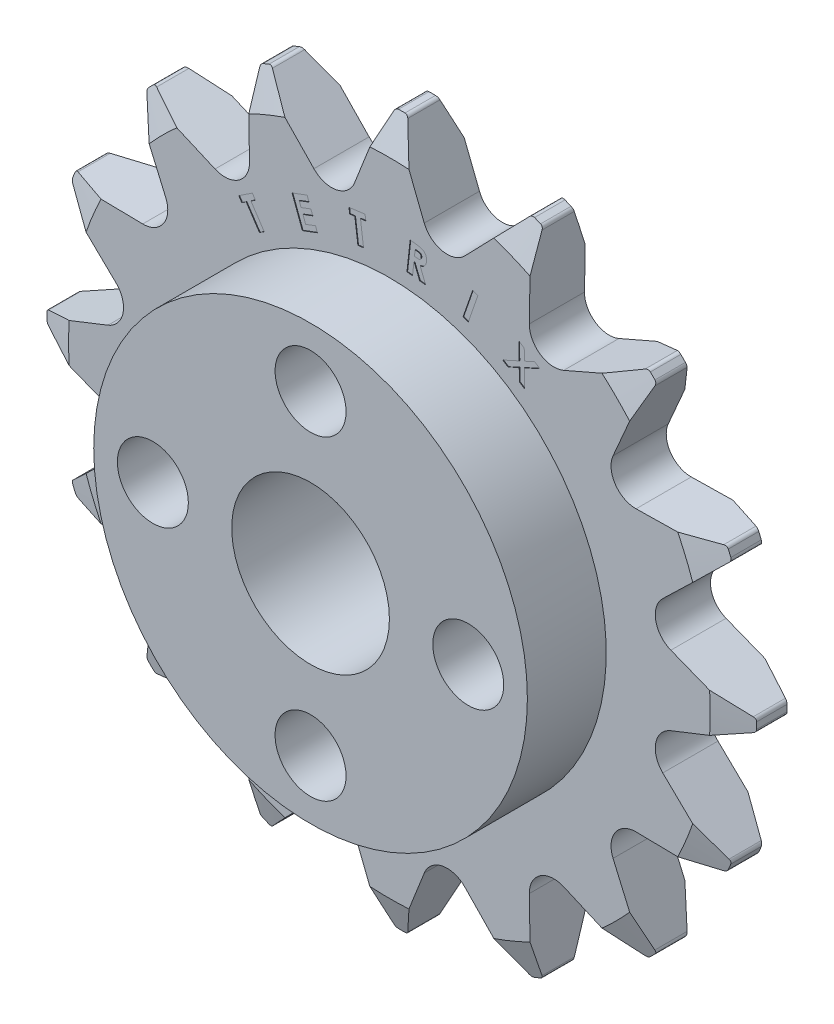
from build123d import *

# Parameters (mm, degrees)
EXTRUDE2_START     = -14.41724753
EXTRUDE2_DEPTH     = 1.63449506
EXTRUDE2_START_2   = -2.8
EXTRUDE2_2_DEPTH   = 2.8
SKETCH3_R          = 7.254666381
EXTRUDE3_DEPTH     = 2.8
SKETCH4_R          = 11
EXTRUDE4_DEPTH     = 4
SKETCH6_R          = 4
SKETCH6_R_2        = 1.8
EXTRUDE6_DEPTH     = 27.348434651
CUT_EXTRUDE1_DEPTH = 0.03125


with BuildPart() as part:
    # Extrude2: read off the stored shape, not the designer's step
    # Extrude2 outline → Extrude2 (new body)
    with BuildSketch(Plane(origin=(0, 0, -15), x_dir=(-1, 0, 0), z_dir=(0, 0, -1)).offset(EXTRUDE2_START)):
        with BuildLine():
            ThreePointArc((12.844111786, 12.610661855), (12.727922061, 12.727922061), (12.610661855, 12.844111786))
            ThreePointArc((12.610661855, 12.844111786), (12.50701837, 12.898045246), (12.390927078, 12.884869439))
            Line((12.390927078, 12.884869439), (8.845044699, 11.34614339))
            ThreePointArc((8.845044699, 11.34614339), (7.65297996, 11.453493909), (7.097617587, 12.513736858))
            Line((7.097617587, 12.513736858), (7.162264649, 16.378549979))
            ThreePointArc((7.162264649, 16.378549979), (7.130011294, 16.490846511), (7.04052063, 16.565961163))
            ThreePointArc((7.04052063, 16.565961163), (6.888301783, 16.629831585), (6.735503595, 16.692303356))
            ThreePointArc((6.735503595, 16.692303356), (6.619110059, 16.702468731), (6.516897854, 16.645869658))
            Line((6.516897854, 16.645869658), (3.829774665, 13.867321716))
            ThreePointArc((3.829774665, 13.867321716), (2.687369186, 13.510317238), (1.768543845, 14.277326018))
            Line((1.768543845, 14.277326018), (0.349269993, 17.872687117))
            ThreePointArc((0.349269993, 17.872687117), (0.276497756, 17.96409276), (0.16507403, 17.999243055))
            ThreePointArc((0.16507403, 17.999243055), (0, 18), (-0.16507403, 17.999243055))
            ThreePointArc((-0.16507403, 17.999243055), (-0.276497756, 17.96409276), (-0.349269993, 17.872687117))
            Line((-0.349269993, 17.872687117), (-1.768543845, 14.277326018))
            ThreePointArc((-1.768543845, 14.277326018), (-2.687369186, 13.510317238), (-3.829774665, 13.867321716))
            Line((-3.829774665, 13.867321716), (-6.516897854, 16.645869658))
            ThreePointArc((-6.516897854, 16.645869658), (-6.619110059, 16.702468731), (-6.735503595, 16.692303356))
            ThreePointArc((-6.735503595, 16.692303356), (-6.888301783, 16.629831585), (-7.04052063, 16.565961163))
            ThreePointArc((-7.04052063, 16.565961163), (-7.130011294, 16.490846511), (-7.162264649, 16.378549979))
            Line((-7.162264649, 16.378549979), (-7.097617587, 12.513736858))
            ThreePointArc((-7.097617587, 12.513736858), (-7.65297996, 11.453493909), (-8.845044699, 11.34614339))
            Line((-8.845044699, 11.34614339), (-12.390927078, 12.884869439))
            ThreePointArc((-12.390927078, 12.884869439), (-12.50701837, 12.898045246), (-12.610661855, 12.844111786))
            ThreePointArc((-12.610661855, 12.844111786), (-12.727922061, 12.727922061), (-12.844111786, 12.610661855))
            ThreePointArc((-12.844111786, 12.610661855), (-12.898045246, 12.50701837), (-12.884869439, 12.390927078))
            Line((-12.884869439, 12.390927078), (-11.34614339, 8.845044699))
            ThreePointArc((-11.34614339, 8.845044699), (-11.453493909, 7.65297996), (-12.513736858, 7.097617587))
            Line((-12.513736858, 7.097617587), (-16.378549979, 7.162264649))
            ThreePointArc((-16.378549979, 7.162264649), (-16.490846511, 7.130011294), (-16.565961163, 7.04052063))
            ThreePointArc((-16.565961163, 7.04052063), (-16.629831585, 6.888301783), (-16.692303356, 6.735503595))
            ThreePointArc((-16.692303356, 6.735503595), (-16.702468731, 6.619110059), (-16.645869658, 6.516897854))
            Line((-16.645869658, 6.516897854), (-13.867321716, 3.829774665))
            ThreePointArc((-13.867321716, 3.829774665), (-13.510317238, 2.687369186), (-14.277326018, 1.768543845))
            Line((-14.277326018, 1.768543845), (-17.872687117, 0.349269993))
            ThreePointArc((-17.872687117, 0.349269993), (-17.96409276, 0.276497756), (-17.999243055, 0.16507403))
            ThreePointArc((-17.999243055, 0.16507403), (-18, 0), (-17.999243055, -0.16507403))
            ThreePointArc((-17.999243055, -0.16507403), (-17.96409276, -0.276497756), (-17.872687117, -0.349269993))
            Line((-17.872687117, -0.349269993), (-14.277326018, -1.768543845))
            ThreePointArc((-14.277326018, -1.768543845), (-13.510317238, -2.687369186), (-13.867321716, -3.829774665))
            Line((-13.867321716, -3.829774665), (-16.645869658, -6.516897854))
            ThreePointArc((-16.645869658, -6.516897854), (-16.702468731, -6.619110059), (-16.692303356, -6.735503595))
            ThreePointArc((-16.692303356, -6.735503595), (-16.629831585, -6.888301783), (-16.565961163, -7.04052063))
            ThreePointArc((-16.565961163, -7.04052063), (-16.490846511, -7.130011294), (-16.378549979, -7.162264649))
            Line((-16.378549979, -7.162264649), (-12.513736858, -7.097617587))
            ThreePointArc((-12.513736858, -7.097617587), (-11.453493909, -7.65297996), (-11.34614339, -8.845044699))
            Line((-11.34614339, -8.845044699), (-12.884869439, -12.390927078))
            ThreePointArc((-12.884869439, -12.390927078), (-12.898045246, -12.50701837), (-12.844111786, -12.610661855))
            ThreePointArc((-12.844111786, -12.610661855), (-12.727922061, -12.727922061), (-12.610661855, -12.844111786))
            ThreePointArc((-12.610661855, -12.844111786), (-12.50701837, -12.898045246), (-12.390927078, -12.884869439))
            Line((-12.390927078, -12.884869439), (-8.845044699, -11.34614339))
            ThreePointArc((-8.845044699, -11.34614339), (-7.65297996, -11.453493909), (-7.097617587, -12.513736858))
            Line((-7.097617587, -12.513736858), (-7.162264649, -16.378549979))
            ThreePointArc((-7.162264649, -16.378549979), (-7.130011294, -16.490846511), (-7.04052063, -16.565961163))
            ThreePointArc((-7.04052063, -16.565961163), (-6.888301783, -16.629831585), (-6.735503595, -16.692303356))
            ThreePointArc((-6.735503595, -16.692303356), (-6.619110059, -16.702468731), (-6.516897854, -16.645869658))
            Line((-6.516897854, -16.645869658), (-3.829774665, -13.867321716))
            ThreePointArc((-3.829774665, -13.867321716), (-2.687369186, -13.510317238), (-1.768543845, -14.277326018))
            Line((-1.768543845, -14.277326018), (-0.349269993, -17.872687117))
            ThreePointArc((-0.349269993, -17.872687117), (-0.276497756, -17.96409276), (-0.16507403, -17.999243055))
            ThreePointArc((-0.16507403, -17.999243055), (0, -18), (0.16507403, -17.999243055))
            ThreePointArc((0.16507403, -17.999243055), (0.276497756, -17.96409276), (0.349269993, -17.872687117))
            Line((0.349269993, -17.872687117), (1.768543845, -14.277326018))
            ThreePointArc((1.768543845, -14.277326018), (2.687369186, -13.510317238), (3.829774665, -13.867321716))
            Line((3.829774665, -13.867321716), (6.516897854, -16.645869658))
            ThreePointArc((6.516897854, -16.645869658), (6.619110059, -16.702468731), (6.735503595, -16.692303356))
            ThreePointArc((6.735503595, -16.692303356), (6.888301783, -16.629831585), (7.04052063, -16.565961163))
            ThreePointArc((7.04052063, -16.565961163), (7.130011294, -16.490846511), (7.162264649, -16.378549979))
            Line((7.162264649, -16.378549979), (7.097617587, -12.513736858))
            ThreePointArc((7.097617587, -12.513736858), (7.65297996, -11.453493909), (8.845044699, -11.34614339))
            Line((8.845044699, -11.34614339), (12.390927078, -12.884869439))
            ThreePointArc((12.390927078, -12.884869439), (12.50701837, -12.898045246), (12.610661855, -12.844111786))
            ThreePointArc((12.610661855, -12.844111786), (12.727922061, -12.727922061), (12.844111786, -12.610661855))
            ThreePointArc((12.844111786, -12.610661855), (12.898045246, -12.50701837), (12.884869439, -12.390927078))
            Line((12.884869439, -12.390927078), (11.34614339, -8.845044699))
            ThreePointArc((11.34614339, -8.845044699), (11.453493909, -7.65297996), (12.513736858, -7.097617587))
            Line((12.513736858, -7.097617587), (16.378549979, -7.162264649))
            ThreePointArc((16.378549979, -7.162264649), (16.490846511, -7.130011294), (16.565961163, -7.04052063))
            ThreePointArc((16.565961163, -7.04052063), (16.629831585, -6.888301783), (16.692303356, -6.735503595))
            ThreePointArc((16.692303356, -6.735503595), (16.702468731, -6.619110059), (16.645869658, -6.516897854))
            Line((16.645869658, -6.516897854), (13.867321716, -3.829774665))
            ThreePointArc((13.867321716, -3.829774665), (13.510317238, -2.687369186), (14.277326018, -1.768543845))
            Line((14.277326018, -1.768543845), (17.872687117, -0.349269993))
            ThreePointArc((17.872687117, -0.349269993), (17.96409276, -0.276497756), (17.999243055, -0.16507403))
            ThreePointArc((17.999243055, -0.16507403), (18, 0), (17.999243055, 0.16507403))
            ThreePointArc((17.999243055, 0.16507403), (17.96409276, 0.276497756), (17.872687117, 0.349269993))
            Line((17.872687117, 0.349269993), (14.277326018, 1.768543845))
            ThreePointArc((14.277326018, 1.768543845), (13.510317238, 2.687369186), (13.867321716, 3.829774665))
            Line((13.867321716, 3.829774665), (16.645869658, 6.516897854))
            ThreePointArc((16.645869658, 6.516897854), (16.702468731, 6.619110059), (16.692303356, 6.735503595))
            ThreePointArc((16.692303356, 6.735503595), (16.629831585, 6.888301783), (16.565961163, 7.04052063))
            ThreePointArc((16.565961163, 7.04052063), (16.490846511, 7.130011294), (16.378549979, 7.162264649))
            Line((16.378549979, 7.162264649), (12.513736858, 7.097617587))
            ThreePointArc((12.513736858, 7.097617587), (11.453493909, 7.65297996), (11.34614339, 8.845044699))
            Line((11.34614339, 8.845044699), (12.884869439, 12.390927078))
            ThreePointArc((12.884869439, 12.390927078), (12.898045246, 12.50701837), (12.844111786, 12.610661855))
        make_face()
        with BuildLine():
            Line((1.5, 6.169696007), (1.5, 4.769696007))
            ThreePointArc((1.5, 4.769696007), (0, -5), (-1.5, 4.769696007))
            Line((-1.5, 4.769696007), (-1.5, 6.169696007))
            Line((-1.5, 6.169696007), (1.5, 6.169696007))
        make_face(mode=Mode.SUBTRACT)
    extrude(amount=EXTRUDE2_DEPTH)

    # Extrude2 2 outline → Extrude2 2 (add)
    with BuildSketch(Plane.XY.offset(EXTRUDE2_START_2)):
        with BuildLine():
            ThreePointArc((-1.768543845, 14.277326018), (-2.687369186, 13.510317238), (-3.829774665, 13.867321716))
            Line((-3.829774665, 13.867321716), (-6.516897854, 16.645869658))
            ThreePointArc((-6.516897854, 16.645869658), (-6.619110059, 16.702468731), (-6.735503595, 16.692303356))
            ThreePointArc((-6.735503595, 16.692303356), (-6.888301783, 16.629831585), (-7.04052063, 16.565961163))
            ThreePointArc((-7.04052063, 16.565961163), (-7.130011294, 16.490846511), (-7.162264649, 16.378549979))
            Line((-7.162264649, 16.378549979), (-7.097617587, 12.513736858))
            ThreePointArc((-7.097617587, 12.513736858), (-7.65297996, 11.453493909), (-8.845044699, 11.34614339))
            Line((-8.845044699, 11.34614339), (-12.390927078, 12.884869439))
            ThreePointArc((-12.390927078, 12.884869439), (-12.50701837, 12.898045246), (-12.610661855, 12.844111786))
            ThreePointArc((-12.610661855, 12.844111786), (-12.727922061, 12.727922061), (-12.844111786, 12.610661855))
            ThreePointArc((-12.844111786, 12.610661855), (-12.898045246, 12.50701837), (-12.884869439, 12.390927078))
            Line((-12.884869439, 12.390927078), (-11.34614339, 8.845044699))
            ThreePointArc((-11.34614339, 8.845044699), (-11.453493909, 7.65297996), (-12.513736858, 7.097617587))
            Line((-12.513736858, 7.097617587), (-16.378549979, 7.162264649))
            ThreePointArc((-16.378549979, 7.162264649), (-16.490846511, 7.130011294), (-16.565961163, 7.04052063))
            ThreePointArc((-16.565961163, 7.04052063), (-16.629831585, 6.888301783), (-16.692303356, 6.735503595))
            ThreePointArc((-16.692303356, 6.735503595), (-16.702468731, 6.619110059), (-16.645869658, 6.516897854))
            Line((-16.645869658, 6.516897854), (-13.867321716, 3.829774665))
            ThreePointArc((-13.867321716, 3.829774665), (-13.510317238, 2.687369186), (-14.277326018, 1.768543845))
            Line((-14.277326018, 1.768543845), (-17.872687117, 0.349269993))
            ThreePointArc((-17.872687117, 0.349269993), (-17.96409276, 0.276497756), (-17.999243055, 0.16507403))
            ThreePointArc((-17.999243055, 0.16507403), (-18, 0), (-17.999243055, -0.16507403))
            ThreePointArc((-17.999243055, -0.16507403), (-17.96409276, -0.276497756), (-17.872687117, -0.349269993))
            Line((-17.872687117, -0.349269993), (-14.277326018, -1.768543845))
            ThreePointArc((-14.277326018, -1.768543845), (-13.510317238, -2.687369186), (-13.867321716, -3.829774665))
            Line((-13.867321716, -3.829774665), (-16.645869658, -6.516897854))
            ThreePointArc((-16.645869658, -6.516897854), (-16.702468731, -6.619110059), (-16.692303356, -6.735503595))
            ThreePointArc((-16.692303356, -6.735503595), (-16.629831585, -6.888301783), (-16.565961163, -7.04052063))
            ThreePointArc((-16.565961163, -7.04052063), (-16.490846511, -7.130011294), (-16.378549979, -7.162264649))
            Line((-16.378549979, -7.162264649), (-12.513736858, -7.097617587))
            ThreePointArc((-12.513736858, -7.097617587), (-11.453493909, -7.65297996), (-11.34614339, -8.845044699))
            Line((-11.34614339, -8.845044699), (-12.884869439, -12.390927078))
            ThreePointArc((-12.884869439, -12.390927078), (-12.898045246, -12.50701837), (-12.844111786, -12.610661855))
            ThreePointArc((-12.844111786, -12.610661855), (-12.727922061, -12.727922061), (-12.610661855, -12.844111786))
            ThreePointArc((-12.610661855, -12.844111786), (-12.50701837, -12.898045246), (-12.390927078, -12.884869439))
            Line((-12.390927078, -12.884869439), (-8.845044699, -11.34614339))
            ThreePointArc((-8.845044699, -11.34614339), (-7.65297996, -11.453493909), (-7.097617587, -12.513736858))
            Line((-7.097617587, -12.513736858), (-7.162264649, -16.378549979))
            ThreePointArc((-7.162264649, -16.378549979), (-7.130011294, -16.490846511), (-7.04052063, -16.565961163))
            ThreePointArc((-7.04052063, -16.565961163), (-6.888301783, -16.629831585), (-6.735503595, -16.692303356))
            ThreePointArc((-6.735503595, -16.692303356), (-6.619110059, -16.702468731), (-6.516897854, -16.645869658))
            Line((-6.516897854, -16.645869658), (-3.829774665, -13.867321716))
            ThreePointArc((-3.829774665, -13.867321716), (-2.687369186, -13.510317238), (-1.768543845, -14.277326018))
            Line((-1.768543845, -14.277326018), (-0.349269993, -17.872687117))
            ThreePointArc((-0.349269993, -17.872687117), (-0.276497756, -17.96409276), (-0.16507403, -17.999243055))
            ThreePointArc((-0.16507403, -17.999243055), (0, -18), (0.16507403, -17.999243055))
            ThreePointArc((0.16507403, -17.999243055), (0.276497756, -17.96409276), (0.349269993, -17.872687117))
            Line((0.349269993, -17.872687117), (1.768543845, -14.277326018))
            ThreePointArc((1.768543845, -14.277326018), (2.687369186, -13.510317238), (3.829774665, -13.867321716))
            Line((3.829774665, -13.867321716), (6.516897854, -16.645869658))
            ThreePointArc((6.516897854, -16.645869658), (6.619110059, -16.702468731), (6.735503595, -16.692303356))
            ThreePointArc((6.735503595, -16.692303356), (6.888301783, -16.629831585), (7.04052063, -16.565961163))
            ThreePointArc((7.04052063, -16.565961163), (7.130011294, -16.490846511), (7.162264649, -16.378549979))
            Line((7.162264649, -16.378549979), (7.097617587, -12.513736858))
            ThreePointArc((7.097617587, -12.513736858), (7.65297996, -11.453493909), (8.845044699, -11.34614339))
            Line((8.845044699, -11.34614339), (12.390927078, -12.884869439))
            ThreePointArc((12.390927078, -12.884869439), (12.50701837, -12.898045246), (12.610661855, -12.844111786))
            ThreePointArc((12.610661855, -12.844111786), (12.727922061, -12.727922061), (12.844111786, -12.610661855))
            ThreePointArc((12.844111786, -12.610661855), (12.898045246, -12.50701837), (12.884869439, -12.390927078))
            Line((12.884869439, -12.390927078), (11.34614339, -8.845044699))
            ThreePointArc((11.34614339, -8.845044699), (11.453493909, -7.65297996), (12.513736858, -7.097617587))
            Line((12.513736858, -7.097617587), (16.378549979, -7.162264649))
            ThreePointArc((16.378549979, -7.162264649), (16.490846511, -7.130011294), (16.565961163, -7.04052063))
            ThreePointArc((16.565961163, -7.04052063), (16.629831585, -6.888301783), (16.692303356, -6.735503595))
            ThreePointArc((16.692303356, -6.735503595), (16.702468731, -6.619110059), (16.645869658, -6.516897854))
            Line((16.645869658, -6.516897854), (13.867321716, -3.829774665))
            ThreePointArc((13.867321716, -3.829774665), (13.510317238, -2.687369186), (14.277326018, -1.768543845))
            Line((14.277326018, -1.768543845), (17.872687117, -0.349269993))
            ThreePointArc((17.872687117, -0.349269993), (17.96409276, -0.276497756), (17.999243055, -0.16507403))
            ThreePointArc((17.999243055, -0.16507403), (18, 0), (17.999243055, 0.16507403))
            ThreePointArc((17.999243055, 0.16507403), (17.96409276, 0.276497756), (17.872687117, 0.349269993))
            Line((17.872687117, 0.349269993), (14.277326018, 1.768543845))
            ThreePointArc((14.277326018, 1.768543845), (13.510317238, 2.687369186), (13.867321716, 3.829774665))
            Line((13.867321716, 3.829774665), (16.645869658, 6.516897854))
            ThreePointArc((16.645869658, 6.516897854), (16.702468731, 6.619110059), (16.692303356, 6.735503595))
            ThreePointArc((16.692303356, 6.735503595), (16.629831585, 6.888301783), (16.565961163, 7.04052063))
            ThreePointArc((16.565961163, 7.04052063), (16.490846511, 7.130011294), (16.378549979, 7.162264649))
            Line((16.378549979, 7.162264649), (12.513736858, 7.097617587))
            ThreePointArc((12.513736858, 7.097617587), (11.453493909, 7.65297996), (11.34614339, 8.845044699))
            Line((11.34614339, 8.845044699), (12.884869439, 12.390927078))
            ThreePointArc((12.884869439, 12.390927078), (12.898045246, 12.50701837), (12.844111786, 12.610661855))
            ThreePointArc((12.844111786, 12.610661855), (12.727922061, 12.727922061), (12.610661855, 12.844111786))
            ThreePointArc((12.610661855, 12.844111786), (12.50701837, 12.898045246), (12.390927078, 12.884869439))
            Line((12.390927078, 12.884869439), (8.845044699, 11.34614339))
            ThreePointArc((8.845044699, 11.34614339), (7.65297996, 11.453493909), (7.097617587, 12.513736858))
            Line((7.097617587, 12.513736858), (7.162264649, 16.378549979))
            ThreePointArc((7.162264649, 16.378549979), (7.130011294, 16.490846511), (7.04052063, 16.565961163))
            ThreePointArc((7.04052063, 16.565961163), (6.888301783, 16.629831585), (6.735503595, 16.692303356))
            ThreePointArc((6.735503595, 16.692303356), (6.619110059, 16.702468731), (6.516897854, 16.645869658))
            Line((6.516897854, 16.645869658), (3.829774665, 13.867321716))
            ThreePointArc((3.829774665, 13.867321716), (2.687369186, 13.510317238), (1.768543845, 14.277326018))
            Line((1.768543845, 14.277326018), (0.349269993, 17.872687117))
            ThreePointArc((0.349269993, 17.872687117), (0.276497756, 17.96409276), (0.16507403, 17.999243055))
            ThreePointArc((0.16507403, 17.999243055), (0, 18), (-0.16507403, 17.999243055))
            ThreePointArc((-0.16507403, 17.999243055), (-0.276497756, 17.96409276), (-0.349269993, 17.872687117))
            Line((-0.349269993, 17.872687117), (-1.768543845, 14.277326018))
        make_face()
        with BuildLine():
            ThreePointArc((1.5, 4.769696007), (0, -5), (-1.5, 4.769696007))
            Line((-1.5, 4.769696007), (-1.5, 6.169696007))
            Line((-1.5, 6.169696007), (1.5, 6.169696007))
            Line((1.5, 6.169696007), (1.5, 4.769696007))
        make_face(mode=Mode.SUBTRACT)
    extrude(amount=EXTRUDE2_2_DEPTH)

    # Extrude2 3 outline → Extrude2 3 (revolve, cut)
    with BuildSketch(Plane.XZ):
        Polygon((18.000001959, 0), (16.275, 0), (18.000001959, -0.627849367), (18.000001959, -0.58275247), align=None)
        Polygon((18.000001959, -2.21724753), (18.000001959, -2.172150633), (16.275, -2.8), (18.000001959, -2.8), align=None)
    revolve(axis=Axis((0, 0, 0), (0, 0, 1)), mode=Mode.SUBTRACT)

    # Sketch3 → Extrude3 (add)
    with BuildSketch(Plane.XY):
        Circle(SKETCH3_R)
    extrude(amount=-EXTRUDE3_DEPTH)

    # Sketch4 → Extrude4 (add)
    with BuildSketch(Plane.XY):
        with Locations(Location((0, 0, 0), (0, 0, 180))):
            Circle(SKETCH4_R)
    extrude(amount=EXTRUDE4_DEPTH)

    # Sketch6 → Extrude6 (cut, through all)
    with BuildSketch(Plane.XY.offset(4)):
        Circle(SKETCH6_R)
        with Locations((0, 8)):
            Circle(SKETCH6_R_2)
        with Locations((0, -8)):
            Circle(SKETCH6_R_2)
        with Locations((8, 0)):
            Circle(SKETCH6_R_2)
        with Locations((-8, 0)):
            Circle(SKETCH6_R_2)
    extrude(amount=-EXTRUDE6_DEPTH, mode=Mode.SUBTRACT)

    # Sketch7 → Cut-Extrude1 (cut)
    # profile 1 of 9: a face of its own
    with BuildSketch(Plane.XY):
        Polygon((-7.640397563, 10.776681226), (-6.953498525, 11.234914399), (-6.797849486, 11.001741322), (-7.024111505, 10.850899976), (-6.350433621, 9.840984111), (-6.590517755, 9.680827861), (-7.26419564, 10.690743726), (-7.484748525, 10.543508149), align=None)
    # profile 2 of 9: a face of its own
    with BuildSketch(Plane.XY):
        Polygon((-4.935748206, 12.249870656), (-4.174029456, 12.534726426), (-4.076974168, 12.27481056), (-4.574870802, 12.088812964), (-4.480519841, 11.836409118), (-3.982623206, 12.022406714), (-3.887070322, 11.767298541), (-4.384966956, 11.581300945), (-4.247947726, 11.214413926), (-3.750051091, 11.400411522), (-3.652394841, 11.139594214), (-4.414113591, 10.854738445), align=None)
    # profile 3 of 9: a face of its own
    with BuildSketch(Plane.XY):
        Polygon((-2.050037848, 13.060788701), (-1.233331117, 13.165356009), (-1.197874386, 12.888012259), (-1.467105156, 12.85345697), (-1.313259002, 11.652735816), (-1.598415252, 11.616377643), (-1.752261406, 12.817098797), (-2.014581117, 12.783444951), align=None)
    # profile 4 of 9: a face of its own
    with BuildSketch(Plane.XY):
        with BuildLine():
            Line((1.052824553, 13.175976967), (1.351201957, 13.143525044))
            add(Edge.make_bspline(
                [(1.351201957, 13.143525044), (1.370851781, 13.141362442), (1.408821856, 13.137183568), (1.463273622, 13.128879259), (1.513368941, 13.120458122), (1.55862498, 13.11046428), (1.599458461, 13.099989154), (1.63583388, 13.08888293), (1.667469031, 13.076163913), (1.703626821, 13.058759372), (1.743019025, 13.03237109), (1.784814057, 12.994748246), (1.819592397, 12.949543606), (1.843870401, 12.907494946), (1.859678512, 12.871104014), (1.869619277, 12.842475848), (1.877441327, 12.812943797), (1.883145235, 12.782512651), (1.886758148, 12.751083925), (1.88819297, 12.718761439), (1.887661016, 12.685432762), (1.885603807, 12.663047155), (1.884555322, 12.651638025)],
                knots=[0, 0, 0, 0, 1.41970539, 2.743348665, 3.955644485, 5.067582177, 6.070885336, 6.983280363, 7.796842392, 8.517539374, 9.862361666, 11.186376336, 12.539160483, 13.940981851, 14.662683489, 15.386175686, 16.115581019, 16.854923156, 17.60806652, 18.385854194, 19.177328525, 20, 20, 20, 20], degree=3))
            add(Edge.make_bspline(
                [(1.884555322, 12.651638025), (1.88298937, 12.639797697), (1.87990871, 12.616504507), (1.873027981, 12.582541177), (1.864056059, 12.550277905), (1.852871469, 12.519891351), (1.839930487, 12.49110765), (1.824926218, 12.464021838), (1.807748221, 12.438662696), (1.788442453, 12.415216785), (1.767235087, 12.393409436), (1.744082956, 12.373222388), (1.71872912, 12.354842308), (1.691324459, 12.338395164), (1.661967289, 12.323458026), (1.63037706, 12.310818453), (1.596970032, 12.299135641), (1.573709124, 12.293192481), (1.561838976, 12.29015966)],
                knots=[0, 0, 0, 0, 1.098012455, 2.160093242, 3.183575417, 4.174250108, 5.134665369, 6.082903294, 7.017853295, 7.947115507, 8.871985751, 9.812047896, 10.768169937, 11.747476982, 12.748373866, 13.793385537, 14.873954517, 16, 16, 16, 16], degree=3))
            Line((1.561838976, 12.29015966), (1.839783688, 11.59514764))
            Line((1.839783688, 11.59514764), (1.532391861, 11.628501006))
            Line((1.532391861, 11.628501006), (1.267668303, 12.29046014))
            Line((1.267668303, 12.29046014), (1.241826957, 12.293164467))
            Line((1.241826957, 12.293164467), (1.173918303, 11.667263025))
            Line((1.173918303, 11.667263025), (0.892367822, 11.697912063))
            Line((0.892367822, 11.697912063), (1.052824553, 13.175976967))
        make_face()
        with BuildLine():
            Line((1.271574553, 12.56750341), (1.359915899, 12.557888025))
            add(Edge.make_bspline(
                [(1.359915899, 12.557888025), (1.370725315, 12.556793478), (1.391413735, 12.554698595), (1.42139611, 12.553149364), (1.448872622, 12.553162398), (1.473848411, 12.554299541), (1.496265785, 12.5565738), (1.516219722, 12.56038378), (1.533717997, 12.565814869), (1.553699088, 12.574306166), (1.574768333, 12.59013403), (1.594138562, 12.615579423), (1.607237069, 12.647716849), (1.610749064, 12.671446819), (1.612620226, 12.684089948)],
                knots=[0, 0, 0, 0, 1.201965654, 2.300472909, 3.320008467, 4.240874368, 5.065713833, 5.811172969, 6.484165131, 7.089525463, 8.206601603, 9.352548079, 10.589459823, 12, 12, 12, 12], degree=3))
            add(Edge.make_bspline(
                [(1.612620226, 12.684089948), (1.613117595, 12.691896447), (1.614088582, 12.707136677), (1.612196792, 12.729759095), (1.605873643, 12.750947474), (1.596917784, 12.770798504), (1.585150977, 12.789019118), (1.570636453, 12.804925445), (1.553891411, 12.818685322), (1.533739622, 12.830495018), (1.507710383, 12.840291969), (1.473653485, 12.84822287), (1.430794295, 12.855586067), (1.399101653, 12.859333715), (1.381850995, 12.861373602)],
                knots=[0, 0, 0, 0, 0.846215851, 1.652024099, 2.441253947, 3.22720092, 4.002988737, 4.778170351, 5.548561449, 6.340615559, 7.294861614, 8.546411195, 10.120173196, 12, 12, 12, 12], degree=3))
            Line((1.381850995, 12.861373602), (1.304627438, 12.869787063))
            Line((1.304627438, 12.869787063), (1.271574553, 12.56750341))
        make_face(mode=Mode.SUBTRACT)
    # profile 5 of 9: a face of its own
    with BuildSketch(Plane.XY):
        Polygon((4.222611876, 12.544730183), (4.488837837, 12.452783068), (4.000857068, 11.043828741), (3.734631107, 11.135775856), align=None)
    # profile 6 of 9: a face of its own
    with BuildSketch(Plane.XY):
        Polygon((6.570667167, 11.490940129), (6.839897936, 11.319966572), (6.847710436, 10.750855995), (7.36874409, 10.984630033), (7.637974859, 10.813656475), (6.851917167, 10.459089168), (6.865138321, 9.541120418), (6.595907552, 9.712093975), (6.585691205, 10.337995418), (6.017482071, 10.078980995), (5.746748898, 10.250855995), (6.582686398, 10.629762245), align=None)
    # profile 7 of 9: a face of its own
    with BuildSketch(Plane.XY):
        Polygon((-1.177458677, -13.169582085), (-1.994165408, -13.069221508), (-1.960211081, -12.791877758), (-1.690980311, -12.824930643), (-1.543444254, -11.624209489), (-1.258288004, -11.659065258), (-1.405824061, -12.859786412), (-1.14350435, -12.892238335), align=None)
    # profile 8 of 9: a face of its own
    with BuildSketch(Plane.XY):
        with BuildLine():
            Line((0.188040899, -13.250959079), (-0.054747563, -13.133170617))
            Line((-0.054747563, -13.133170617), (0.199459168, -12.622954271))
            add(Edge.make_bspline(
                [(0.199459168, -12.622954271), (0.183910566, -12.622802915), (0.153289035, -12.622504833), (0.108265836, -12.616029751), (0.064846489, -12.606479567), (0.023332969, -12.591739803), (-0.016499349, -12.57299586), (-0.054877781, -12.550243944), (-0.090918066, -12.522443841), (-0.125331576, -12.491538742), (-0.156795679, -12.457231925), (-0.184047384, -12.420068677), (-0.207848814, -12.381273662), (-0.226808187, -12.339932544), (-0.241744976, -12.296627338), (-0.253103547, -12.251233231), (-0.259604912, -12.203666805), (-0.260847815, -12.171250032), (-0.261478332, -12.154805232)],
                knots=[0, 0, 0, 0, 1.017811775, 2.004485942, 2.974073551, 3.926810731, 4.88394586, 5.855308865, 6.843727739, 7.861349053, 8.883384131, 9.88756198, 10.876939131, 11.860640196, 12.861079198, 13.87505372, 14.922029797, 16, 16, 16, 16], degree=3))
            add(Edge.make_bspline(
                [(-0.261478332, -12.154805232), (-0.261324343, -12.138857069), (-0.261020989, -12.107439648), (-0.254592939, -12.06130923), (-0.244955496, -12.016814934), (-0.230301229, -11.974288583), (-0.211691456, -11.933394829), (-0.188273134, -11.894651932), (-0.161164839, -11.857330238), (-0.129732092, -11.8226329), (-0.095515964, -11.790544174), (-0.058758208, -11.762632482), (-0.020408496, -11.738629879), (0.019777796, -11.719014428), (0.061850073, -11.703538379), (0.105777264, -11.692559202), (0.151454386, -11.685396157), (0.182505505, -11.684238598), (0.198257245, -11.683651386)],
                knots=[0, 0, 0, 0, 1.043929067, 2.056510165, 3.045183985, 4.02262139, 4.997500054, 5.983382237, 6.983553784, 8.015199928, 9.046010867, 10.052705807, 11.034210161, 12.005659299, 12.97728574, 13.965676394, 14.968019962, 16, 16, 16, 16], degree=3))
            add(Edge.make_bspline(
                [(0.198257245, -11.683651386), (0.214802026, -11.683815714), (0.247209355, -11.684137592), (0.294839677, -11.690343254), (0.340289595, -11.700907585), (0.383991549, -11.715466831), (0.425160549, -11.7354676), (0.464956668, -11.758643226), (0.501891403, -11.787429111), (0.536838623, -11.819452307), (0.568223634, -11.854784757), (0.596466009, -11.891291132), (0.619975347, -11.929571407), (0.639819731, -11.96893636), (0.654658436, -12.010088537), (0.666023299, -12.052248231), (0.672650936, -12.095907858), (0.67389144, -12.125437223), (0.674519264, -12.140382156)],
                knots=[0, 0, 0, 0, 1.082600903, 2.120560211, 3.137103477, 4.134662624, 5.129134247, 6.12901891, 7.144270897, 8.188509658, 9.228766186, 10.234825947, 11.206680558, 12.165749689, 13.116033682, 14.065706464, 15.021046155, 16, 16, 16, 16], degree=3))
            add(Edge.make_bspline(
                [(0.674519264, -12.140382156), (0.674378956, -12.151907397), (0.674096531, -12.175106281), (0.670733959, -12.209973248), (0.664668872, -12.245015266), (0.657327893, -12.274500543), (0.649745236, -12.299390427), (0.642180513, -12.320429148), (0.632671303, -12.343714254), (0.622387141, -12.369784247), (0.609502017, -12.397834999), (0.595587081, -12.428529062), (0.579400189, -12.461312838), (0.568244657, -12.484030103), (0.562439937, -12.495850906)],
                knots=[0, 0, 0, 0, 1.101097236, 2.216372363, 3.343048367, 4.496801556, 5.11747492, 5.828927975, 6.632307217, 7.52101489, 8.506461365, 9.581413942, 10.741502131, 12, 12, 12, 12], degree=3))
            Line((0.562439937, -12.495850906), (0.188040899, -13.250959079))
        make_face()
        with BuildLine():
            add(Edge.make_bspline(
                [(0.212680322, -12.354023982), (0.225508997, -12.353331835), (0.250508355, -12.35198304), (0.285826184, -12.339652158), (0.318270443, -12.321628167), (0.345752893, -12.295651314), (0.369248628, -12.265311575), (0.385347449, -12.230112578), (0.395570663, -12.191642436), (0.396232282, -12.164790256), (0.396574553, -12.150898982)],
                knots=[0, 0, 0, 0, 1.003371462, 1.955279168, 2.905758166, 3.895992034, 4.90044029, 5.898967277, 6.913085682, 8, 8, 8, 8], degree=3))
            add(Edge.make_bspline(
                [(0.396574553, -12.150898982), (0.395837981, -12.136992472), (0.394403581, -12.109910914), (0.382780121, -12.071323024), (0.364528826, -12.036320658), (0.339426116, -12.006094307), (0.310551242, -11.98052925), (0.278059645, -11.962027143), (0.243035048, -11.950996674), (0.218867346, -11.949853373), (0.206670707, -11.949276386)],
                knots=[0, 0, 0, 0, 1.08444429, 2.111848295, 3.119734191, 4.148567048, 5.163503405, 6.116448913, 7.049434046, 8, 8, 8, 8], degree=3))
            add(Edge.make_bspline(
                [(0.206670707, -11.949276386), (0.193850414, -11.94999294), (0.168676527, -11.951399961), (0.132774638, -11.963627314), (0.099576124, -11.982147616), (0.070502213, -12.008088242), (0.046103717, -12.03912289), (0.028361604, -12.074648353), (0.017749911, -12.114030857), (0.016903412, -12.141516399), (0.01646638, -12.155706675)],
                knots=[0, 0, 0, 0, 0.981643843, 1.927552731, 2.881304905, 3.883866931, 4.897484643, 5.894724864, 6.913085456, 8, 8, 8, 8], degree=3))
            add(Edge.make_bspline(
                [(0.01646638, -12.155706675), (0.017188071, -12.169520924), (0.01859341, -12.196421207), (0.030396663, -12.234524158), (0.047772307, -12.269401064), (0.072708388, -12.299184563), (0.102183043, -12.323992772), (0.136115832, -12.341724277), (0.173331227, -12.352764023), (0.199381215, -12.353598144), (0.212680322, -12.354023982)],
                knots=[0, 0, 0, 0, 1.062137277, 2.068284197, 3.048611643, 4.04673375, 5.038899724, 5.998685955, 6.978283946, 8, 8, 8, 8], degree=3))
        make_face(mode=Mode.SUBTRACT)
    # profile 9 of 9: a face of its own
    with BuildSketch(Plane.XY):
        Polygon((1.750643872, -13.100344172), (1.329670314, -13.147519653), (1.164105411, -11.669454749), (1.443552526, -11.638204749), (1.579670314, -12.851846576), (1.884057334, -12.817892249), align=None)
    extrude(amount=-CUT_EXTRUDE1_DEPTH, mode=Mode.SUBTRACT)


solid = part.part
